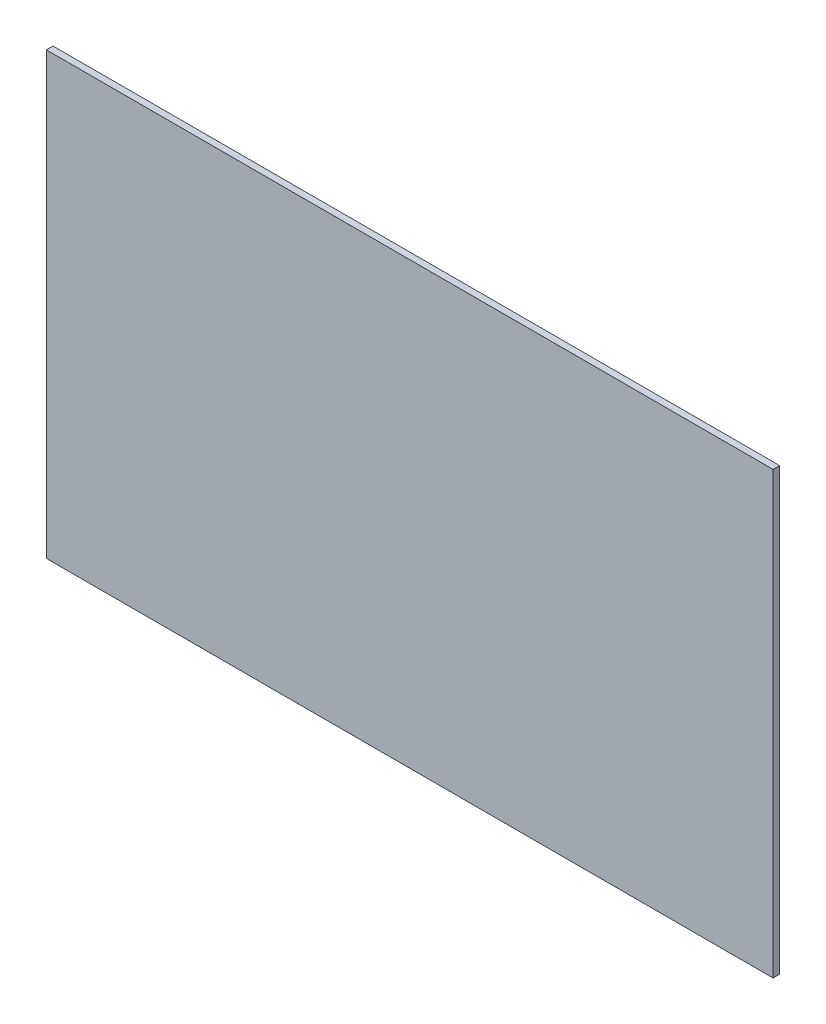
from build123d import *

# Parameters (mm, degrees)
CROQUIS1_W              = 330
CROQUIS1_H              = 200
SALIENTE_EXTRUIR1_DEPTH = 3


with BuildPart() as part:
    # Croquis1 → Saliente-Extruir1 (new body)
    with BuildSketch(Plane.XY):
        Rectangle(CROQUIS1_W, CROQUIS1_H)
    extrude(amount=SALIENTE_EXTRUIR1_DEPTH)


solid = part.part
